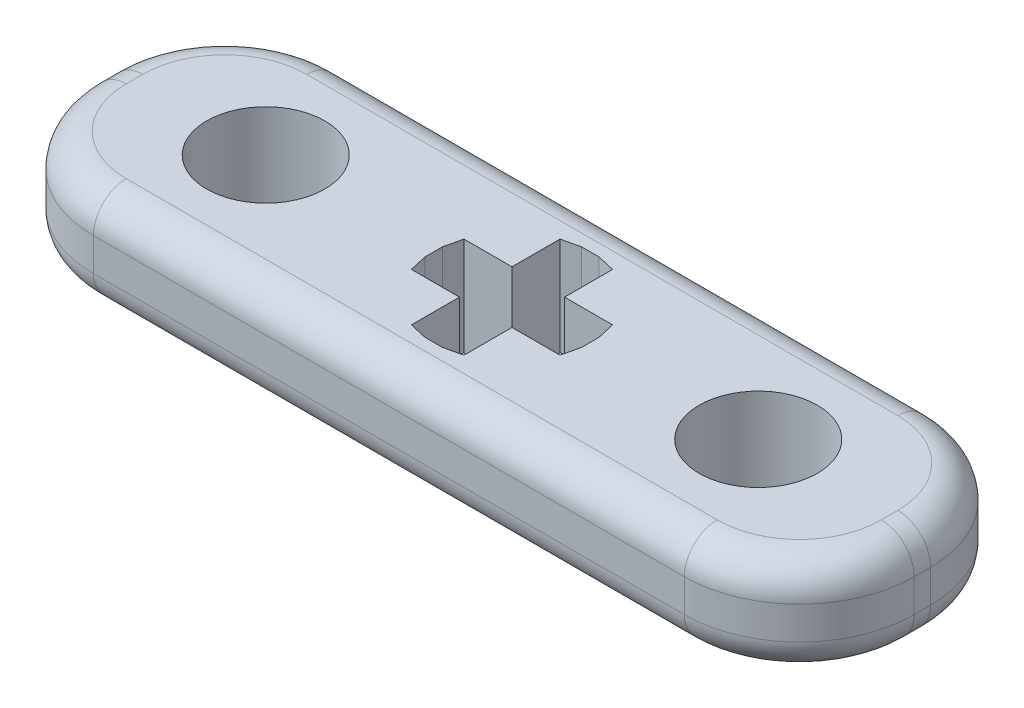
from build123d import *

# Parameters (mm, degrees)
SKETCH1_W            = 25
SKETCH1_H            = 7.5
BOSS_EXTRUDE1_DEPTH  = 3
FILLET4_R            = 3.5
M3_CLEARANCE_HOLE1_D = 3.6
FILLET6_R            = 1


with BuildPart() as part:
    # Sketch1 → Boss-Extrude1 (new body)
    with BuildSketch(Plane(origin=(0, 0, 0), x_dir=(1, 0, 0), z_dir=(0, 1, 0))):
        Rectangle(SKETCH1_W, SKETCH1_H)
        Polygon((-0.8, 0.8), (-0.8, 2.2627417), (-0.270125178, 2.384749963), (0.270125178, 2.384749963), (0.8, 2.2627417), (0.8, 0.8), (2.2627417, 0.8), (2.384749963, 0.270125178), (2.384749963, -0.270125178), (2.2627417, -0.8), (0.8, -0.8), (0.8, -2.2627417), (0.270125178, -2.384749963), (-0.270125178, -2.384749963), (-0.8, -2.2627417), (-0.8, -0.8), (-2.2627417, -0.8), (-2.384749963, -0.270125178), (-2.384749963, 0.270125178), (-2.2627417, 0.8), align=None, mode=Mode.SUBTRACT)
    extrude(amount=BOSS_EXTRUDE1_DEPTH)

    # Fillet4
    fillet4_edges = [part.edges().sort_by_distance(p)[0] for p in [
        (12.5, 1.5, -3.75),
        (12.5, 1.5, 3.75),
        (-12.5, 1.5, 3.75),
        (-12.5, 1.5, -3.75),
    ]]
    fillet(fillet4_edges, radius=FILLET4_R)

    # M3 Clearance Hole1 (through all)
    with Locations(Plane.XZ):
        with Locations((-7.5, 0), (7.5, 0)):
            Hole(M3_CLEARANCE_HOLE1_D / 2)

    # Fillet6
    fillet6_edges = [part.edges().sort_by_distance(p)[0] for p in [
        (-11.474873734, 3, 2.724873734),
        (0, 3, 3.75),
        (11.474873734, 3, 2.724873734),
        (11.474873734, 3, -2.724873734),
        (0, 3, -3.75),
        (-11.474873734, 3, -2.724873734),
        (-11.474873734, 0, 2.724873734),
        (0, 0, 3.75),
        (11.474873734, 0, 2.724873734),
        (11.474873734, 0, -2.724873734),
        (0, 0, -3.75),
        (-11.474873734, 0, -2.724873734),
        (12.5, 3, 0),
        (12.5, 0, 0),
        (-12.5, 3, 0),
        (-12.5, 0, 0),
    ]]
    fillet(fillet6_edges, radius=FILLET6_R)


solid = part.part
